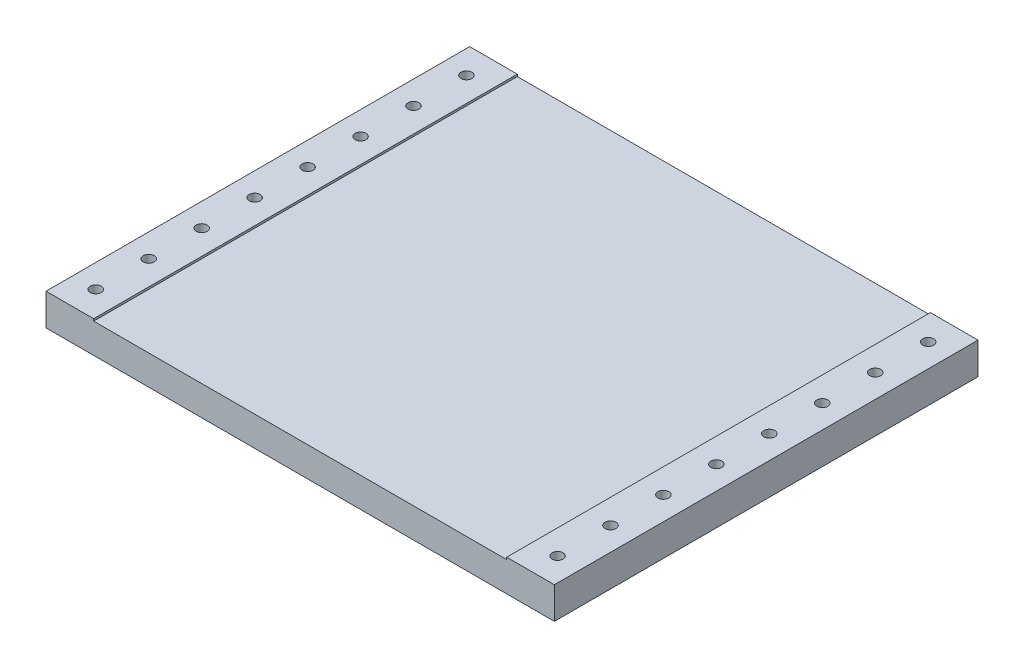
from build123d import *

# Parameters (mm, degrees)
SKETCH1_W           = 240
SKETCH1_H           = 200
BOSS_EXTRUDE1_DEPTH = 7.5
CUT_EXTRUDE2_DEPTH  = 1
SKETCH4_R           = 2.6
CUT_EXTRUDE3_DEPTH  = 157.923548265
LPATTERN1_COUNT     = 8
LPATTERN1_PITCH     = 25


with BuildPart() as part:
    # Sketch1 → Boss-Extrude1 (new, symmetric)
    with BuildSketch(Plane(origin=(0, 0, 0), x_dir=(1, 0, 0), z_dir=(0, 1, 0))):
        Rectangle(SKETCH1_W, SKETCH1_H)
    extrude(amount=BOSS_EXTRUDE1_DEPTH, both=True)

    # Sketch3 → Cut-Extrude2 (cut)
    with BuildSketch(Plane(origin=(0, 7.5, 0), x_dir=(1, 0, 0), z_dir=(0, 1, 0))):
        with BuildLine():
            Line((-92.5, -105), (92.5, -105))
            ThreePointArc((92.5, -105), (96.035533906, -103.535533906), (97.5, -100))
            Line((97.5, -100), (97.5, 100))
            ThreePointArc((97.5, 100), (96.035533906, 103.535533906), (92.5, 105))
            Line((92.5, 105), (-92.5, 105))
            ThreePointArc((-92.5, 105), (-96.035533906, 103.535533906), (-97.5, 100))
            Line((-97.5, 100), (-97.5, -100))
            ThreePointArc((-97.5, -100), (-96.035533906, -103.535533906), (-92.5, -105))
        make_face()
    extrude(amount=-CUT_EXTRUDE2_DEPTH, mode=Mode.SUBTRACT)

    # Sketch4 → Cut-Extrude3 (cut, through all)
    with BuildSketch(Plane(origin=(0, 7.5, 0), x_dir=(1, 0, 0), z_dir=(0, 1, 0))):
        with Locations((-109, 87.5)):
            Circle(SKETCH4_R)
        with Locations((109, 87.5)):
            Circle(SKETCH4_R)
    cut_extrude3 = extrude(amount=-CUT_EXTRUDE3_DEPTH, mode=Mode.SUBTRACT)

    # LPattern1: Cut-Extrude3 ×8
    with Locations(*[(0, 0, i * LPATTERN1_PITCH) for i in range(1, LPATTERN1_COUNT)]):
        add(cut_extrude3, mode=Mode.SUBTRACT)


solid = part.part
